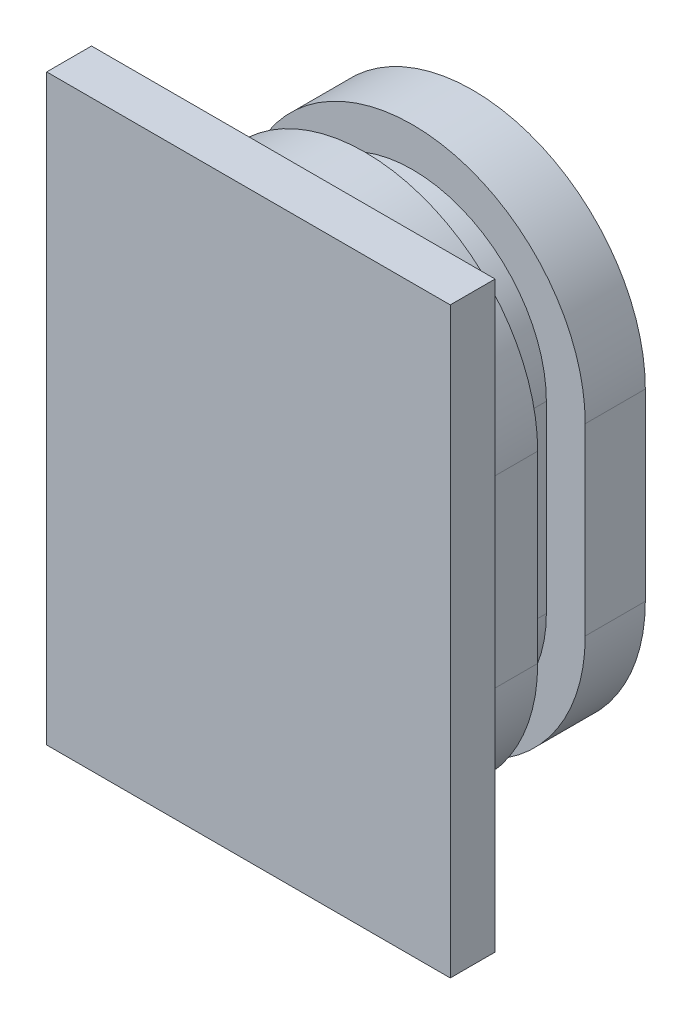
from build123d import *

# Parameters (mm, degrees)
SKETCH1_W           = 45
SKETCH1_H           = 65
BOSS_EXTRUDE1_DEPTH = 5
BOSS_EXTRUDE2_DEPTH = 20
BOSS_EXTRUDE3_DEPTH = 5.3


with BuildPart() as part:
    # Sketch1 → Boss-Extrude1 (new body)
    with BuildSketch(Plane.XY):
        with Locations((2.886207951, -16.286739239)):
            Rectangle(SKETCH1_W, SKETCH1_H)
    extrude(amount=BOSS_EXTRUDE1_DEPTH)

    # Sketch4 → Boss-Extrude2 (add)
    with BuildSketch(Plane(origin=(0, 0, 0), x_dir=(-1, 0, 0), z_dir=(0, 0, -1))):
        with BuildLine():
            Line((16.363792049, -6.036739239), (16.363792049, -26.536739239))
            ThreePointArc((16.363792049, -26.536739239), (-2.886207951, -45.786739239), (-22.136207951, -26.536739239))
            Line((-22.136207951, -26.536739239), (-22.136207951, -6.036739239))
            ThreePointArc((-22.136207951, -6.036739239), (-2.886207951, 13.213260761), (16.363792049, -6.036739239))
        make_face()
        with BuildLine():
            Line((7.863792049, -6.036739239), (7.863792049, -26.536739239))
            ThreePointArc((7.863792049, -26.536739239), (-2.886207951, -37.286739239), (-13.636207951, -26.536739239))
            Line((-13.636207951, -26.536739239), (-13.636207951, -6.036739239))
            ThreePointArc((-13.636207951, -6.036739239), (-2.886207951, 4.713260761), (7.863792049, -6.036739239))
        make_face(mode=Mode.SUBTRACT)
    extrude(amount=BOSS_EXTRUDE2_DEPTH)


with BuildPart() as body_2:
    # Sketch6 → Boss-Extrude3 (new body)
    with BuildSketch(Plane(origin=(0, 0, 0), x_dir=(-1, 0, 0), z_dir=(0, 0, -1))):
        with BuildLine():
            Line((16.363792049, -6.036739239), (16.363792049, -26.536739239))
            ThreePointArc((16.363792049, -26.536739239), (-2.886207951, -45.786739239), (-22.136207951, -26.536739239))
            Line((-22.136207951, -26.536739239), (-22.136207951, -6.036739239))
            ThreePointArc((-22.136207951, -6.036739239), (-2.886207951, 13.213260761), (16.363792049, -6.036739239))
        make_face()
        with BuildLine():
            Line((12.029792049, -6.036739239), (12.029792049, -26.536739239))
            ThreePointArc((12.029792049, -26.536739239), (-2.886207951, -41.452739239), (-17.802207951, -26.536739239))
            Line((-17.802207951, -26.536739239), (-17.802207951, -6.036739239))
            ThreePointArc((-17.802207951, -6.036739239), (-2.886207951, 8.879260761), (12.029792049, -6.036739239))
        make_face(mode=Mode.SUBTRACT)
    extrude(amount=BOSS_EXTRUDE3_DEPTH)


with BuildPart() as body_2_1:
    # Body-Move/Copy1: read off the stored shape, not the designer's step
    # Body-Move/Copy1: moved
    add(body_2.part.moved(Location((0, 0, -8))))


with BuildPart() as part_1:
    add(part.part)

    # Combine1: cut body 2
    add(body_2_1.part, mode=Mode.SUBTRACT)


solid = part_1.part
